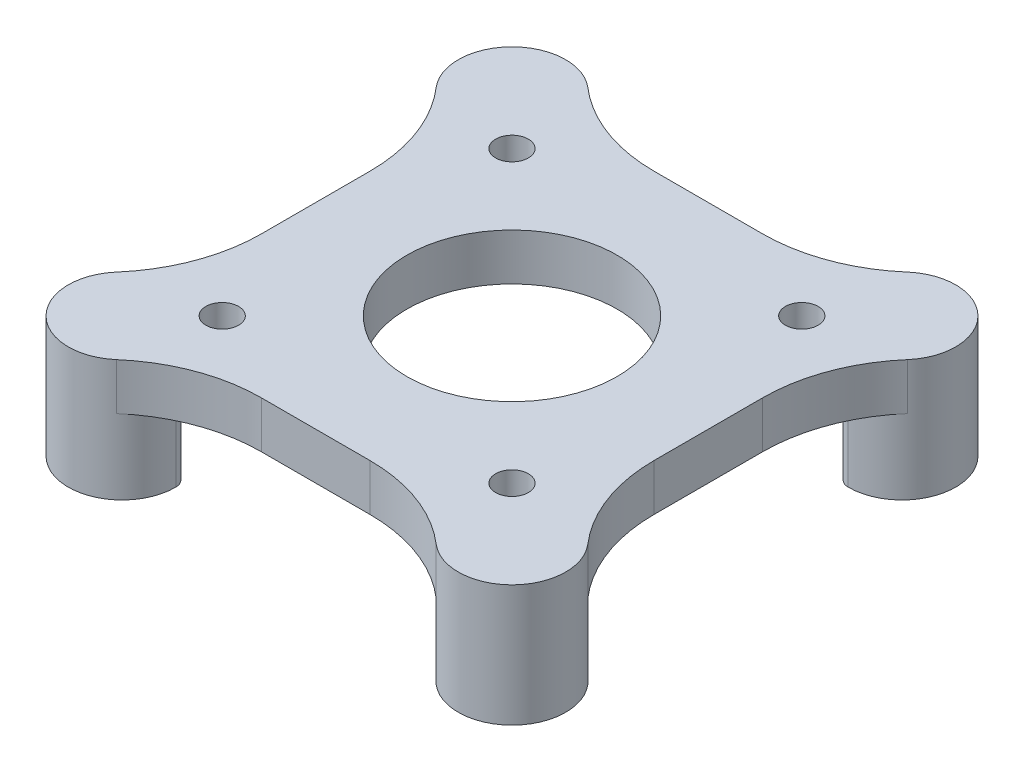
from build123d import *
from build123d.topology import SkipClean

# Parameters (mm, degrees)
SKETCH_1_W      = 42
SKETCH_1_H      = 42
SKETCH_1_R      = 11.25
SKETCH_1_R_2    = 1.75
EXTRUDE_1_DEPTH = 5
EXTRUDE_2_DEPTH = 5
EXTRUDE_START   = 8
EXTRUDE_3_DEPTH = 8


with BuildPart() as part:
    # 草图1 → 凸台-拉伸1 (new body)
    with BuildSketch(Plane(origin=(0, 0, 0), x_dir=(1, 0, 0), z_dir=(0, 1, 0))):
        Rectangle(SKETCH_1_W, SKETCH_1_H)
        Circle(SKETCH_1_R, mode=Mode.SUBTRACT)
        with Locations((15.5, 15.5)):
            Circle(SKETCH_1_R_2, mode=Mode.SUBTRACT)
        with Locations((15.5, -15.5)):
            Circle(SKETCH_1_R_2, mode=Mode.SUBTRACT)
        with Locations((-15.5, -15.5)):
            Circle(SKETCH_1_R_2, mode=Mode.SUBTRACT)
        with Locations((-15.5, 15.5)):
            Circle(SKETCH_1_R_2, mode=Mode.SUBTRACT)
    extrude(amount=EXTRUDE_1_DEPTH)

    # 草图2 → 凸台-拉伸2 (add)
    with BuildSketch(Plane(origin=(0, 0, 0), x_dir=(1, 0, 0), z_dir=(0, 1, 0))):
        with BuildLine():
            Line((-5.80218169, -21), (-21, -21))
            Line((-21, -21), (-21, -5.80218169))
            ThreePointArc((-21, -5.80218169), (-22.086185579, -11.829035113), (-25.208061098, -17.097493573))
            ThreePointArc((-25.208061098, -17.097493573), (-24.925514037, -24.925514037), (-17.097493573, -25.208061098))
            ThreePointArc((-17.097493573, -25.208061098), (-11.829035113, -22.086185579), (-5.80218169, -21))
        make_face()
        with BuildLine():
            Line((21, -5.80218169), (21, -21))
            Line((21, -21), (5.80218169, -21))
            ThreePointArc((5.80218169, -21), (11.829035113, -22.086185579), (17.097493573, -25.208061098))
            ThreePointArc((17.097493573, -25.208061098), (24.925514037, -24.925514037), (25.208061098, -17.097493573))
            ThreePointArc((25.208061098, -17.097493573), (22.086185579, -11.829035113), (21, -5.80218169))
        make_face()
        with BuildLine():
            Line((-21, 5.80218169), (-21, 21))
            Line((-21, 21), (-5.80218169, 21))
            ThreePointArc((-5.80218169, 21), (-11.829035113, 22.086185579), (-17.097493573, 25.208061098))
            ThreePointArc((-17.097493573, 25.208061098), (-24.925514037, 24.925514037), (-25.208061098, 17.097493573))
            ThreePointArc((-25.208061098, 17.097493573), (-22.086185579, 11.829035113), (-21, 5.80218169))
        make_face()
        with BuildLine():
            Line((5.80218169, 21), (21, 21))
            Line((21, 21), (21, 5.80218169))
            ThreePointArc((21, 5.80218169), (22.086185579, 11.829035113), (25.208061098, 17.097493573))
            ThreePointArc((25.208061098, 17.097493573), (24.925514037, 24.925514037), (17.097493573, 25.208061098))
            ThreePointArc((17.097493573, 25.208061098), (11.829035113, 22.086185579), (5.80218169, 21))
        make_face()
    extrude(amount=EXTRUDE_2_DEPTH)

    # 草图3 → 凸台-拉伸3 (add)
    with SkipClean():  # the faces are left unmerged after this step: merging them gives an invalid solid
        with BuildSketch(Plane.XZ.offset(EXTRUDE_START)):
            with BuildLine():
                ThreePointArc((20.859650045, 15.109650045), (24.925514037, 24.925514037), (15.109650045, 20.859650045))
                ThreePointArc((15.109650045, 20.859650045), (16.434650045, 19.534650045), (17.759650045, 20.859650045))
                ThreePointArc((17.759650045, 20.859650045), (23.051681067, 23.051681067), (20.859650045, 17.759650045))
                ThreePointArc((20.859650045, 17.759650045), (19.534650045, 16.434650045), (20.859650045, 15.109650045))
            make_face()
            with BuildLine():
                ThreePointArc((15.109650045, -20.859650045), (24.925514037, -24.925514037), (20.859650045, -15.109650045))
                ThreePointArc((20.859650045, -15.109650045), (19.534650045, -16.434650045), (20.859650045, -17.759650045))
                ThreePointArc((20.859650045, -17.759650045), (23.051681067, -23.051681067), (17.759650045, -20.859650045))
                ThreePointArc((17.759650045, -20.859650045), (16.434650045, -19.534650045), (15.109650045, -20.859650045))
            make_face()
            with BuildLine():
                ThreePointArc((-20.859650045, -15.109650045), (-24.925514037, -24.925514037), (-15.109650045, -20.859650045))
                ThreePointArc((-15.109650045, -20.859650045), (-16.434650045, -19.534650045), (-17.759650045, -20.859650045))
                ThreePointArc((-17.759650045, -20.859650045), (-23.051681067, -23.051681067), (-20.859650045, -17.759650045))
                ThreePointArc((-20.859650045, -17.759650045), (-19.534650045, -16.434650045), (-20.859650045, -15.109650045))
            make_face()
            with BuildLine():
                ThreePointArc((-15.109650045, 20.859650045), (-24.925514037, 24.925514037), (-20.859650045, 15.109650045))
                ThreePointArc((-20.859650045, 15.109650045), (-19.534650045, 16.434650045), (-20.859650045, 17.759650045))
                ThreePointArc((-20.859650045, 17.759650045), (-23.051681067, 23.051681067), (-17.759650045, 20.859650045))
                ThreePointArc((-17.759650045, 20.859650045), (-16.434650045, 19.534650045), (-15.109650045, 20.859650045))
            make_face()
        extrude(amount=-EXTRUDE_3_DEPTH)


solid = part.part
